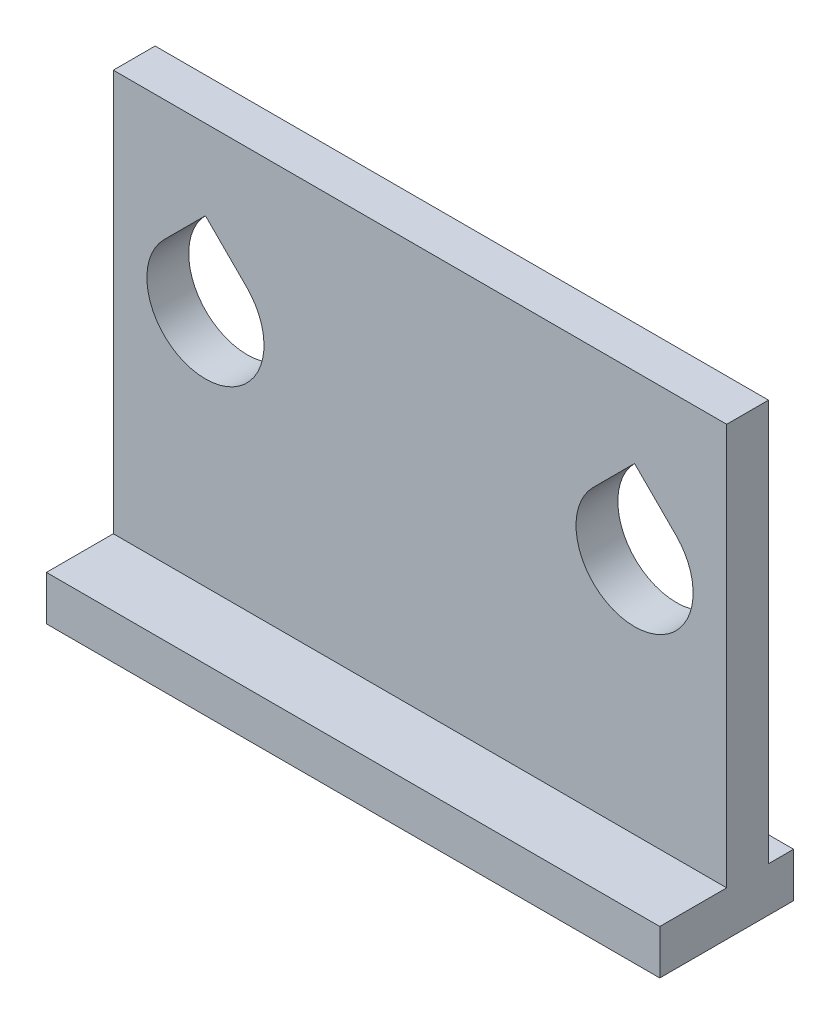
from build123d import *

# Parameters (mm, degrees)
SKETCH1_W                = 110
SKETCH1_H                = 80
BOSS_EXTRUDE1_DEPTH      = 7.5
BOSS_EXTRUDE2_DEPTH      = 12
BOSS_EXTRUDE2_DEPTH_BACK = 12
SKETCH3_W                = 110
SKETCH3_H                = 8


with BuildPart() as part:
    # Sketch1 → Boss-Extrude1 (new body)
    with BuildSketch(Plane.XY):
        with Locations((0, 40)):
            Rectangle(SKETCH1_W, SKETCH1_H)
        with BuildLine():
            ThreePointArc((-27.981, 50.8), (-42.49917604, 41.099264909), (-45.905621202, 58.224621202))
            Line((-45.905621202, 58.224621202), (-38.481, 65.649242405))
            Line((-38.481, 65.649242405), (-31.056378798, 58.224621202))
            ThreePointArc((-31.056378798, 58.224621202), (-28.780264909, 54.81817604), (-27.981, 50.8))
        make_face(mode=Mode.SUBTRACT)
        with BuildLine():
            ThreePointArc((27.981, 50.8), (28.780264909, 54.81817604), (31.056378798, 58.224621202))
            Line((31.056378798, 58.224621202), (38.481, 65.649242405))
            Line((38.481, 65.649242405), (45.905621202, 58.224621202))
            ThreePointArc((45.905621202, 58.224621202), (48.181735091, 54.81817604), (48.981, 50.8))
            ThreePointArc((48.981, 50.8), (38.481, 40.3), (27.981, 50.8))
        make_face(mode=Mode.SUBTRACT)
    extrude(amount=BOSS_EXTRUDE1_DEPTH)

    # Sketch3 → Boss-Extrude2 (add, two sides: drawn at the far end of the back side and taken through both)
    with BuildSketch(Plane.XY.offset(7.5).offset(-BOSS_EXTRUDE2_DEPTH_BACK)):
        with Locations((0, 4)):
            Rectangle(SKETCH3_W, SKETCH3_H)
    extrude(amount=BOSS_EXTRUDE2_DEPTH + BOSS_EXTRUDE2_DEPTH_BACK)


solid = part.part
